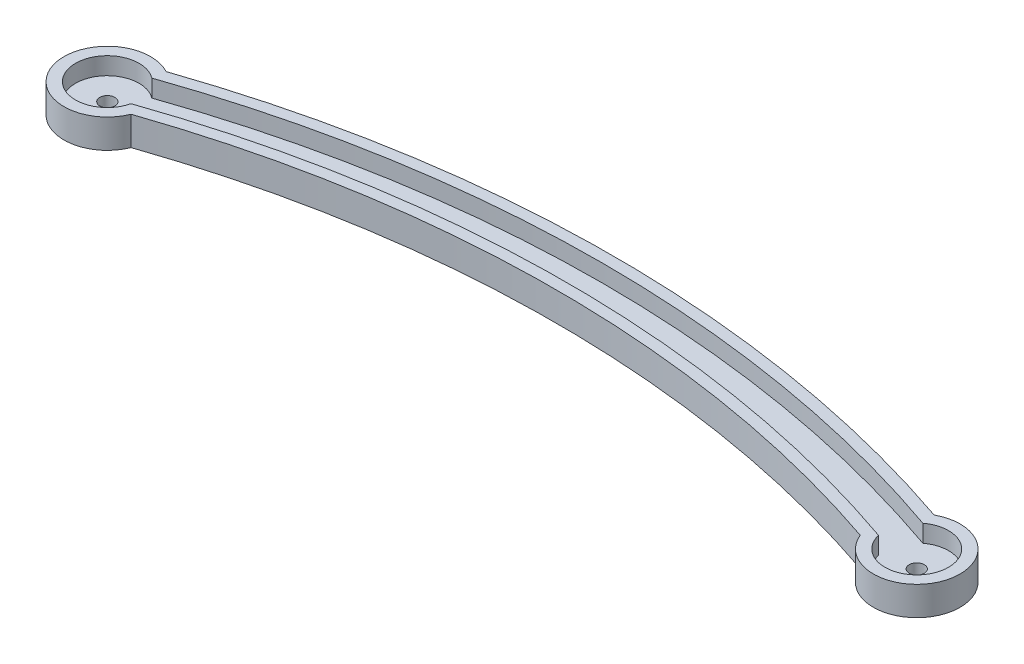
from build123d import *

# Parameters (mm, degrees)
DODANIE_WYCI_GNI_CIE2_DEPTH  = 5
SKORUPA2_START               = 2
SKORUPA2_DEPTH               = 3
SZKIC5_W                     = 1.3
SZKIC5_H                     = 2.001
OTW_R_POD_RUB_M22_AT_2_COUNT = 2
OTW_R_POD_RUB_M22_AT_2_PITCH = 140


# Read off the part's stored shape, not the designer's step: Skorupa2
with BuildPart() as part:
    # Szkic4 → Dodanie-wyciągnięcie2 (new body)
    with BuildSketch(Plane(origin=(0, 0, 0), x_dir=(1, 0, 0), z_dir=(0, 1, 0))):
        with BuildLine():
            ThreePointArc((3.578481933, 6.591241693), (-7.061624869, -2.526549863), (6.947544161, -2.825177894))
            ThreePointArc((6.947544161, -2.825177894), (70, 7.650060048), (133.052455839, -2.825177894))
            ThreePointArc((133.052455839, -2.825177894), (147.061624869, -2.526549863), (136.421518067, 6.591241693))
            ThreePointArc((136.421518067, 6.591241693), (70, 17.650060048), (3.578481933, 6.591241693))
        make_face()
    extrude(amount=DODANIE_WYCI_GNI_CIE2_DEPTH)

    # Skorupa2 outline → Skorupa2 (cut)
    with BuildSketch(Plane(origin=(0, 0, 0), x_dir=(1, 0, 0), z_dir=(0, 1, 0)).offset(SKORUPA2_START)):
        with BuildLine():
            ThreePointArc((3.318777837, 4.385853813), (-5.173966338, -1.865495198), (5.353998671, -1.258847978))
            ThreePointArc((5.353998671, -1.258847978), (70, 9.650060048), (134.646001329, -1.258847978))
            ThreePointArc((134.646001329, -1.258847978), (145.173966338, -1.865495198), (136.681222163, 4.385853813))
            ThreePointArc((136.681222163, 4.385853813), (70, 15.650060048), (3.318777837, 4.385853813))
        make_face()
    extrude(amount=SKORUPA2_DEPTH, mode=Mode.SUBTRACT)

    # Szkic5 → Otwór pod śrubę M22 (revolve, cut)
    with BuildSketch(Plane(origin=(0, 2, 0), x_dir=(0, 0, 1), z_dir=(1, 0, 0))):
        with Locations((0.65, 1.0005)):
            Rectangle(SZKIC5_W, SZKIC5_H)
    otw_r_pod_rub_m22 = revolve(axis=Axis((0, 8.35, 0), (0, -1, 0)), mode=Mode.SUBTRACT)

    # Otwór pod śrubę M22 at 2: Otwór pod śrubę M22 ×2
    with Locations(*[(i * OTW_R_POD_RUB_M22_AT_2_PITCH, 0, 0) for i in range(1, OTW_R_POD_RUB_M22_AT_2_COUNT)]):
        add(otw_r_pod_rub_m22, mode=Mode.SUBTRACT)


solid = part.part
